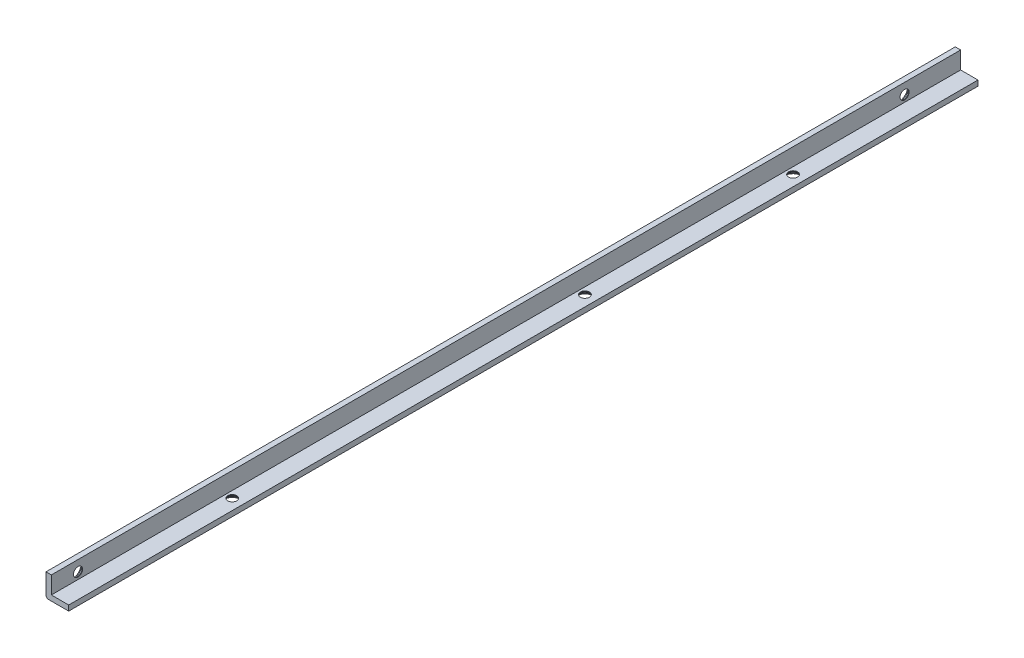
from build123d import *

# Parameters (mm, degrees)
BOSS_EXTRUDE1_DEPTH = 340.5
FILLET1_R           = 1


with BuildPart() as part:
    # Sketch1 → Boss-Extrude1 (new body)
    with BuildSketch(Plane.XY):
        Polygon((0, 0), (-8.5, 0), (-8.5, 8.5), (-6.5, 8.5), (-6.5, 2), (0, 2), align=None)
    extrude(amount=BOSS_EXTRUDE1_DEPTH)

    # Fillet1
    fillet1_edges = [part.edges().sort_by_distance(p)[0] for p in [
        (-8.5, 0, 170.25),
    ]]
    fillet(fillet1_edges, radius=FILLET1_R)

    # Sketch7 → CSK for M3 Countersunk Flat Head Screw1 (revolve, cut)
    with BuildSketch(Plane(origin=(-8.5, 4.5, 21), x_dir=(0, 0, 1), z_dir=(0, 1, 0))):
        Polygon((0, 0), (0, 10.521463052), (1.7, 9.5), (1.7, 1.75), (3.15, 0.3), (3.15, 0), align=None)
    revolve(axis=Axis((-14.85, 4.5, 21), (1, 0, 0)), mode=Mode.SUBTRACT)

    # Sketch7 at point 2 (carried to point 2, square into its face) → CSK for M3 Countersunk Flat Head Scr 2 (revolve, cut)
    with BuildSketch(Plane(origin=(-4, 0, 65.25), x_dir=(0, 0, 1), z_dir=(-1, 0, 0))):
        Polygon((0, 0), (0, 10.521463052), (1.7, 9.5), (1.7, 1.75), (3.15, 0.3), (3.15, 0), align=None)
    revolve(axis=Axis((-4, -6.35, 65.25), (0, 1, 0)), mode=Mode.SUBTRACT)

    # Sketch7 at point 3 (carried to point 3, square into its face) → CSK for M3 Countersunk Flat Head Scr 3 (revolve, cut)
    with BuildSketch(Plane(origin=(-4, 0, 143.19999924), x_dir=(0, 0, 1), z_dir=(-1, 0, 0))):
        Polygon((0, 0), (0, 10.521463052), (1.7, 9.5), (1.7, 1.75), (3.15, 0.3), (3.15, 0), align=None)
    revolve(axis=Axis((-4, -6.35, 143.19999924), (0, 1, 0)), mode=Mode.SUBTRACT)

    # Sketch7 at point 4 (carried to point 4, square into its face) → CSK for M3 Countersunk Flat Head Scr 4 (revolve, cut)
    with BuildSketch(Plane(origin=(-4, 0, 275.25), x_dir=(0, 0, 1), z_dir=(-1, 0, 0))):
        Polygon((0, 0), (0, 10.521463052), (1.7, 9.5), (1.7, 1.75), (3.15, 0.3), (3.15, 0), align=None)
    revolve(axis=Axis((-4, -6.35, 275.25), (0, 1, 0)), mode=Mode.SUBTRACT)

    # Sketch7 at point 5 (carried to point 5, square into its face) → CSK for M3 Countersunk Flat Head Scr 5 (revolve, cut)
    with BuildSketch(Plane(origin=(-8.5, 4.5, 330.5), x_dir=(0, 0, 1), z_dir=(0, 1, 0))):
        Polygon((0, 0), (0, 10.521463052), (1.7, 9.5), (1.7, 1.75), (3.15, 0.3), (3.15, 0), align=None)
    revolve(axis=Axis((-14.85, 4.5, 330.5), (1, 0, 0)), mode=Mode.SUBTRACT)


solid = part.part
